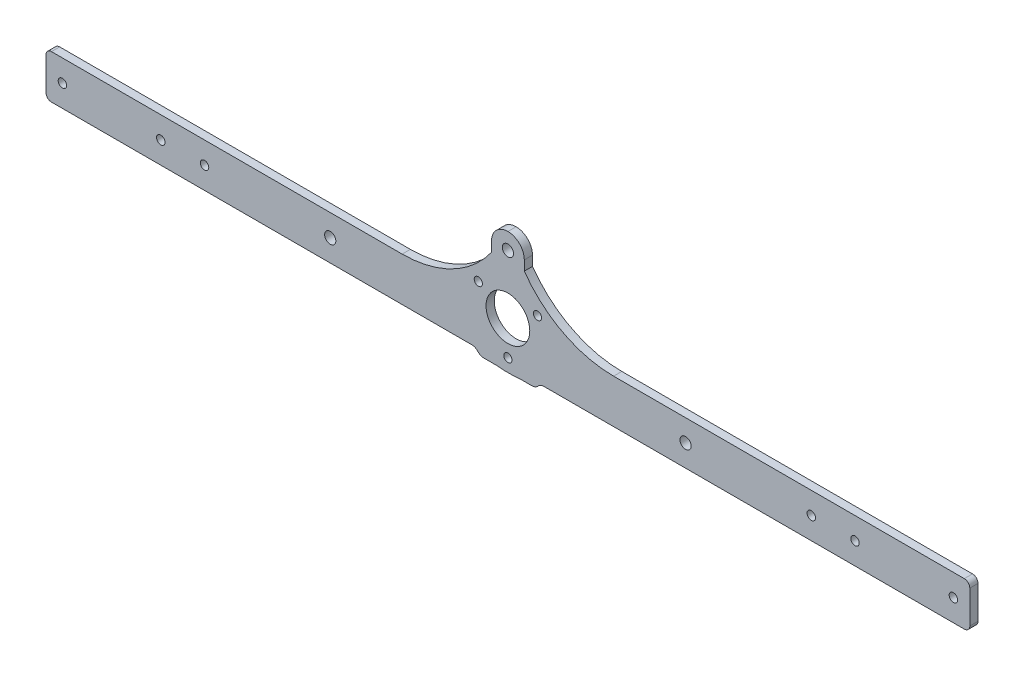
from build123d import *

# Parameters (mm, degrees)
SKETCH_8_R          = 8
SKETCH_8_R_2        = 1.5
SKETCH_8_R_3        = 1.55
SKETCH_8_R_4        = 2.05
EXTRUDE_2522_DEPTH  = 3
FILLET_27_R         = 6
FILLET_30_R         = 3
FILLET_31_R         = 2
SKETCH_9_R          = 2.05
CUT_EXTRUDE_1_DEPTH = 172.249087589


with BuildPart() as part:
    # Эскиз8 → Extrude 2522 (new body)
    with BuildSketch(Plane.XY):
        with BuildLine():
            Line((38.676576093, 1), (169, 1))
            Line((169, 1), (169, -15))
            Line((169, -15), (90, -15))
            Line((90, -15), (12, -15))
            Line((12, -15), (10, -17))
            Line((10, -17), (4.230786919, -17))
            ThreePointArc((4.230786919, -17), (0, -17.231764199), (-4.230786919, -17))
            Line((-4.230786919, -17), (-10, -17))
            Line((-10, -17), (-12, -15))
            Line((-12, -15), (-90, -15))
            Line((-90, -15), (-169, -15))
            Line((-169, -15), (-169, 1))
            Line((-169, 1), (-38.676576093, 1))
            ThreePointArc((-38.676576093, 1), (-20.275683212, 5.483705976), (-6, 17.929642941))
            Line((-6, 17.929642941), (-6, 27.5))
            Line((-6, 27.5), (6, 27.5))
            Line((6, 27.5), (6, 17.929642941))
            ThreePointArc((6, 17.929642941), (20.275683212, 5.483705976), (38.676576093, 1))
        make_face()
        Circle(SKETCH_8_R, mode=Mode.SUBTRACT)
        with Locations((0, -12.5)):
            Circle(SKETCH_8_R_2, mode=Mode.SUBTRACT)
        with Locations((163, -7)):
            Circle(SKETCH_8_R_3, mode=Mode.SUBTRACT)
        with Locations((111, -7)):
            Circle(SKETCH_8_R_3, mode=Mode.SUBTRACT)
        with Locations((0, 21.5)):
            Circle(SKETCH_8_R_4, mode=Mode.SUBTRACT)
        with Locations((127, -7)):
            Circle(SKETCH_8_R_3, mode=Mode.SUBTRACT)
        with Locations((-10.825317547, 6.25)):
            Circle(SKETCH_8_R_2, mode=Mode.SUBTRACT)
        with Locations((10.825317547, 6.25)):
            Circle(SKETCH_8_R_2, mode=Mode.SUBTRACT)
        with Locations(Location((-127, -7, 0), (0, 0, 180))):
            Circle(SKETCH_8_R_3, mode=Mode.SUBTRACT)
        with Locations(Location((-111, -7, 0), (0, 0, 180))):
            Circle(SKETCH_8_R_3, mode=Mode.SUBTRACT)
        with Locations(Location((-163, -7, 0), (0, 0, 180))):
            Circle(SKETCH_8_R_3, mode=Mode.SUBTRACT)
    extrude(amount=EXTRUDE_2522_DEPTH)

    # Скругление27
    fillet_27_edges = [part.edges().sort_by_distance(p)[0] for p in [
        (-6, 27.5, 1.5),
        (6, 27.5, 1.5),
    ]]
    fillet(fillet_27_edges, radius=FILLET_27_R - 0.0001)  # a hair under: the kernel refuses the full size

    # Скругление30
    fillet_30_edges = [part.edges().sort_by_distance(p)[0] for p in [
        (12, -15, 1.5),
        (10, -17, 1.5),
        (-10, -17, 1.5),
        (-12, -15, 1.5),
    ]]
    fillet(fillet_30_edges, radius=FILLET_30_R)

    # Скругление31
    fillet_31_edges = [part.edges().sort_by_distance(p)[0] for p in [
        (169, 1, 1.5),
        (169, -15, 1.5),
        (-169, -15, 1.5),
        (-169, 1, 1.5),
    ]]
    fillet(fillet_31_edges, radius=FILLET_31_R)

    # Эскиз9 → Вырез-Вытянуть1 (cut, through all)
    with BuildSketch(Plane.XY.offset(3)):
        with Locations((-65, -7)):
            Circle(SKETCH_9_R)
        with Locations(Location((65, -7, 0), (0, 0, 180))):
            Circle(SKETCH_9_R)
    extrude(amount=-CUT_EXTRUDE_1_DEPTH, mode=Mode.SUBTRACT)


solid = part.part
